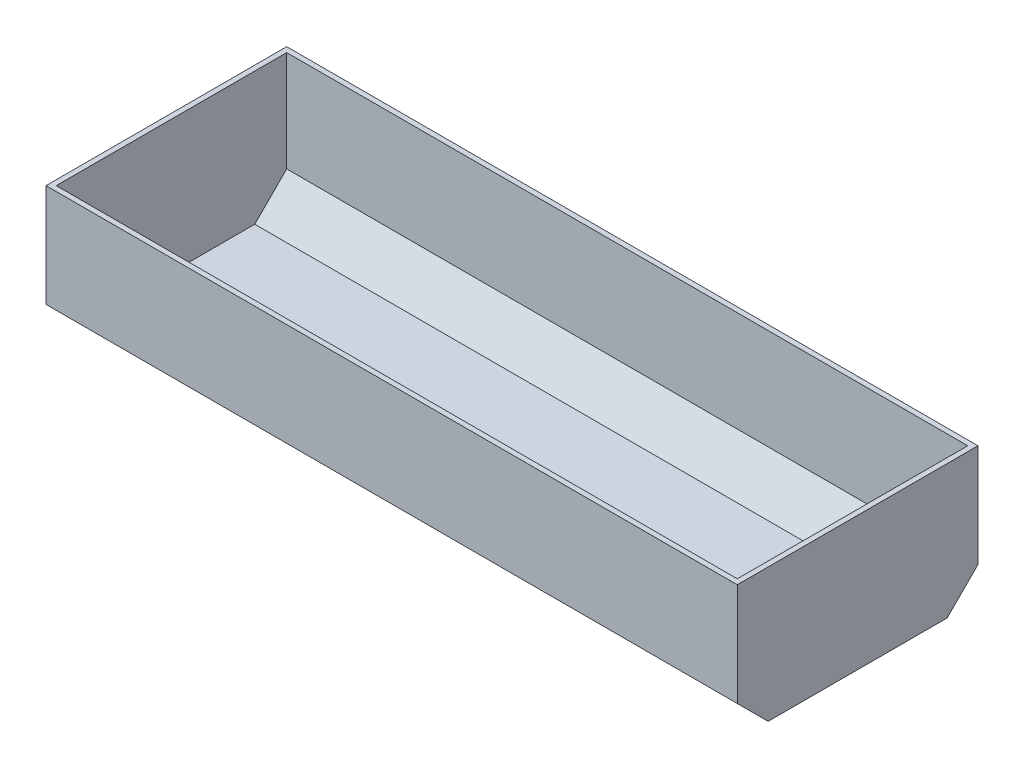
from build123d import *

# Parameters (mm, degrees)
SKETCH1_W           = 6720
SKETCH1_H           = 2340
BOSS_EXTRUDE1_DEPTH = 1300
CHAMFER1_SIZE       = 300
SHELL1_START        = -3310
SHELL1_DEPTH        = 6620


# Read off the part's stored shape, not the designer's step: Shell1
with BuildPart() as part:
    # Sketch1 → Boss-Extrude1 (new body)
    with BuildSketch(Plane(origin=(0, 0, 0), x_dir=(1, 0, 0), z_dir=(0, 1, 0))):
        Rectangle(SKETCH1_W, SKETCH1_H)
    extrude(amount=BOSS_EXTRUDE1_DEPTH)

    # Chamfer1
    chamfer1_edges = [part.edges().sort_by_distance(p)[0] for p in [
        (0, 0, 1170),
        (0, 0, -1170),
    ]]
    chamfer(chamfer1_edges, length=CHAMFER1_SIZE)

    # Shell1 outline → Shell1 (cut)
    with BuildSketch(Plane.YZ.offset(SHELL1_START)):
        Polygon((320.710678119, -1120), (1300, -1120), (1300, 1120), (320.710678119, 1120), (10, 809.289321881), (10, -809.289321881), align=None)
    extrude(amount=SHELL1_DEPTH, mode=Mode.SUBTRACT)


solid = part.part
